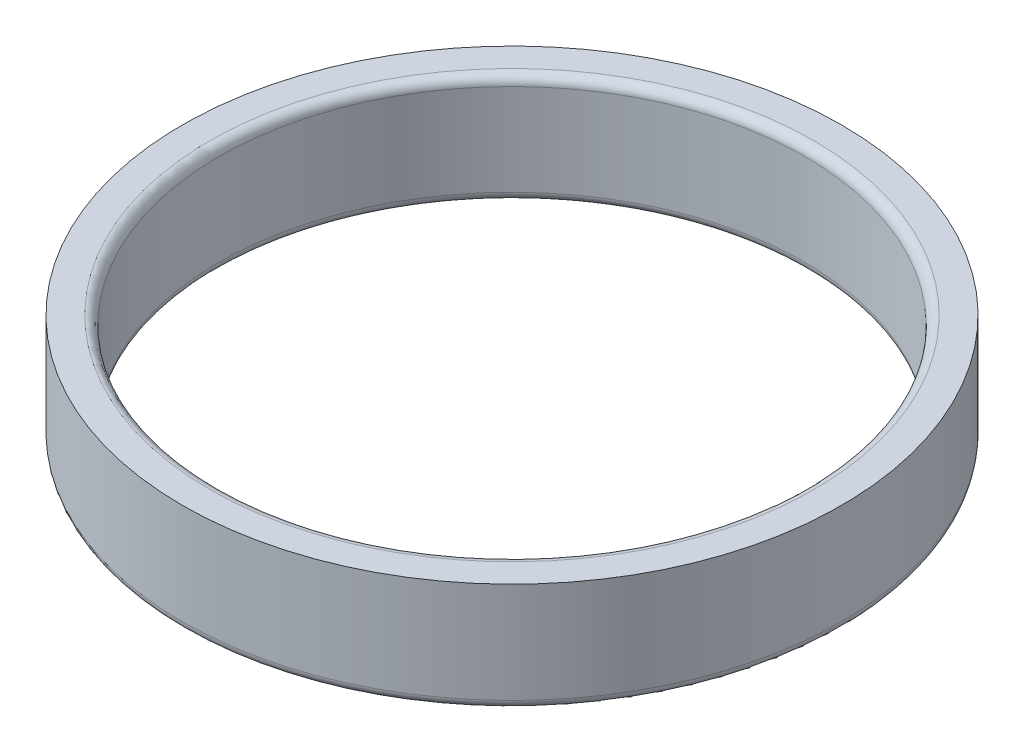
from build123d import *

# Parameters (mm, degrees)
SKETCH_1_R      = 9
SKETCH_1_R_2    = 8
EXTRUDE_1_DEPTH = 3
FILLET_1_R      = 0.25


with BuildPart() as part:
    # 草图1 → 凸台-拉伸1 (new body)
    with BuildSketch(Plane(origin=(0, 0, 0), x_dir=(1, 0, 0), z_dir=(0, 1, 0))):
        Circle(SKETCH_1_R)
        Circle(SKETCH_1_R_2, mode=Mode.SUBTRACT)
    extrude(amount=EXTRUDE_1_DEPTH)

    # 圆角1
    fillet_1_edges = [part.edges().sort_by_distance(p)[0] for p in [
        (-8, 3, 0),
        (-8, 0, 0),
        (-9, 0, 0),
    ]]
    fillet(fillet_1_edges, radius=FILLET_1_R)


solid = part.part
